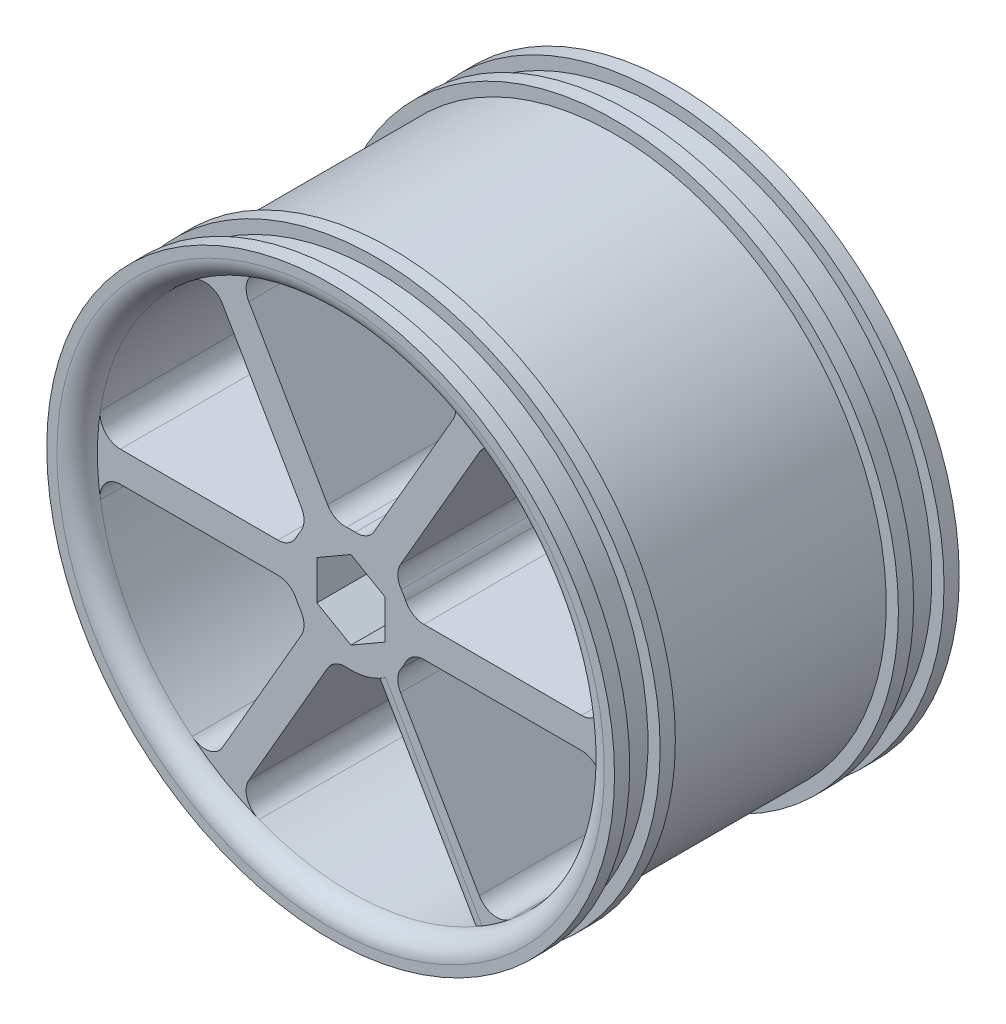
from build123d import *

# Parameters (mm, degrees)
SKETCH2_W           = 25
SKETCH2_H           = 3
BOSS_EXTRUDE1_DEPTH = 32
CIRPATTERN1_COUNT   = 6
SKETCH5_R           = 6
BOSS_EXTRUDE2_DEPTH = 32
AXLEHOLE_DEPTH      = 53.191951405
FILLET1_R           = 2


with BuildPart() as part:
    # Sketch1 → Revolve1 (revolve)
    with BuildSketch(Plane.XZ, mode=Mode.PRIVATE) as revolve1_sk:
        with BuildLine():
            Line((25, 0), (28, 0))
            Line((28, 0), (28, 1.5))
            Line((28, 1.5), (26.8, 1.5))
            Line((26.8, 1.5), (26.8, 4.5))
            Line((26.8, 4.5), (28, 4.5))
            Line((28, 4.5), (28, 6))
            Line((28, 6), (26.8, 6))
            Line((26.8, 6), (26.8, 28))
            Line((26.8, 28), (28, 28))
            Line((28, 28), (28, 29.5))
            Line((28, 29.5), (26.8, 29.5))
            Line((26.8, 29.5), (26.8, 32.5))
            Line((26.8, 32.5), (28, 32.5))
            Line((28, 32.5), (28, 33.999996833))
            Line((28, 33.999996833), (27, 33.999996833))
            ThreePointArc((27, 33.999996833), (25.585786438, 33.414213562), (25, 32))
            Line((25, 32), (25, 0))
        make_face()
    revolve(revolve1_sk.sketch.rotate(Axis((0, 0, 34), (0, 0, -1)), 180), axis=Axis((0, 0, 34), (0, 0, -1)))

    # Sketch2 → Boss-Extrude1 (add)
    with BuildSketch(Plane.XY):
        with Locations((12.5, 0)):
            Rectangle(SKETCH2_W, SKETCH2_H)
    boss_extrude1 = extrude(amount=BOSS_EXTRUDE1_DEPTH)

    # CirPattern1: Boss-Extrude1 ×6 about axis
    cirpattern1_axis = Axis((0, 0, 0), (0, 0, 1))
    for i in range(1, CIRPATTERN1_COUNT):
        add(boss_extrude1.rotate(cirpattern1_axis, i * 360 / CIRPATTERN1_COUNT))

    # Sketch5 → Boss-Extrude2 (add)
    with BuildSketch(Plane.XY):
        Circle(SKETCH5_R)
    extrude(amount=BOSS_EXTRUDE2_DEPTH)

    # Sketch6 → AxleHole (cut, through all)
    with BuildSketch(Plane.XY):
        Polygon((0, -3.87), (3.351518313, -1.935), (3.351518313, 1.935), (0, 3.87), (-3.351518313, 1.935), (-3.351518313, -1.935), align=None)
    extrude(amount=AXLEHOLE_DEPTH, mode=Mode.SUBTRACT)

    # Fillet1
    # the kernel refuses this fillet: 2 mm, written as the material it adds along each edge
    with BuildSketch(Plane(origin=(-24.954959427, -1.5, 32), x_dir=(0.10620109039764976, -0.9943446728365121, 0), z_dir=(0, 0, -1))) as fillet1_piece_1:
        with BuildLine():
            CenterArc((2.224755634, -1.997850608), FILLET1_R, 87.343441845, 98.752929077)
            Line((0.236066288, -2.210252789), (0.196292501, -2.214500833))
            Line((0.196292501, -2.214500833), (-0.039773787, -0.004248044))
            Line((-0.039773787, -0.004248044), (-0.001853963, 0.039957012))
            ThreePointArc((-0.001853963, 0.039957012), (1.158726893, 0.066867397), (2.319307748, 0.039957012))
            Line((2.319307748, 0.039957012), (2.317453785, 0))
        make_face()
    extrude(amount=32)
    with BuildSketch(Plane(origin=(-13.776517819, -20.861628814, 32), x_dir=(-0.8080272015953212, 0.589145178612228, 0), z_dir=(0, 0, -1)), Plane(origin=(13.776517819, 20.861628814, 32), x_dir=(0.8080272015953204, -0.589145178612229, 0), z_dir=(0, 0, -1)), Plane(origin=(24.954959427, -1.5, 32), x_dir=(-0.10620109039765001, -0.994344672836512, 0), z_dir=(0, 0, -1)), Plane(origin=(-11.178441608, 22.361628814, 32), x_dir=(0.9142282919929711, 0.4051994942242834, 0), z_dir=(0, 0, -1)), Plane(origin=(-24.954959427, 1.5, 32), x_dir=(0.10620109039765026, 0.994344672836512, 0), z_dir=(0, 0, -1))) as fillet1_piece_2:
        with BuildLine():
            CenterArc((2.224755634, 1.997850608), FILLET1_R, 173.903629078, 98.752929077)
            Line((0.236066288, 2.210252789), (0.196292501, 2.214500833))
            Line((0.196292501, 2.214500833), (-0.039773787, 0.004248044))
            Line((-0.039773787, 0.004248044), (-0.001853963, -0.039957012))
            ThreePointArc((-0.001853963, -0.039957012), (1.158726893, -0.066867397), (2.319307748, -0.039957012))
            Line((2.319307748, -0.039957012), (2.317453785, 0))
        make_face()
    extrude(amount=32)
    with BuildSketch(Plane(origin=(-11.178441608, -22.361628814, 32), x_dir=(0.5000000000000002, 0.8660254037844387, 0), z_dir=(0, 0, -1)), Plane(origin=(13.776517819, -20.861628814, 32), x_dir=(-0.5000000000000002, 0.8660254037844387, 0), z_dir=(0, 0, -1)), Plane(origin=(24.954959427, 1.5, 32), x_dir=(-1, 0, 0), z_dir=(0, 0, -1)), Plane(origin=(11.178441608, 22.361628814, 32), x_dir=(-0.4999999999999994, -0.8660254037844389, 0), z_dir=(0, 0, -1)), Plane(origin=(-13.776517819, 20.861628814, 32), x_dir=(0.5000000000000007, -0.8660254037844382, 0), z_dir=(0, 0, -1))) as fillet1_piece_3:
        with BuildLine():
            CenterArc((2.222823584, 2), FILLET1_R, 171.247070923, 98.752929077)
            Line((0.246116119, 2.304347826), (0.20658197, 2.310434783))
            ThreePointArc((0.20658197, 2.310434783), (0.056568819, 1.159275304), (-0.039927935, 0.0024))
            Line((-0.039927935, 0.0024), (0, -0.04))
            Line((0, -0.04), (2.222823584, -0.04))
            Line((2.222823584, -0.04), (2.222823584, 0))
        make_face()
    extrude(amount=32)
    with BuildSketch(Plane(origin=(5.809475019, 1.5, 32), x_dir=(1, 0, 0), z_dir=(0, 0, -1)), Plane(origin=(4.203775615, -4.281152949, 32), x_dir=(0.5000000000000001, -0.8660254037844386, 0), z_dir=(0, 0, -1)), Plane(origin=(1.605699404, 5.781152949, 32), x_dir=(0.4999999999999986, 0.8660254037844394, 0), z_dir=(0, 0, -1)), Plane(origin=(-4.203775615, 4.281152949, 32), x_dir=(-0.5000000000000004, 0.8660254037844384, 0), z_dir=(0, 0, -1)), Plane(origin=(-5.809475019, -1.5, 32), x_dir=(-1, 0, 0), z_dir=(0, 0, -1)), Plane(origin=(-1.605699404, -5.781152949, 32), x_dir=(-0.4999999999999988, -0.8660254037844393, 0), z_dir=(0, 0, -1))) as fillet1_piece_4:
        with BuildLine():
            CenterArc((1.384272266, -2), FILLET1_R, 90, 64.055520228)
            Line((-0.414164556, -1.125), (-0.450133292, -1.1075))
            ThreePointArc((-0.450133292, -1.1075), (-0.216451666, -0.559050695), (-0.038729833, 0.01))
            Line((-0.038729833, 0.01), (0, 0.04))
            Line((0, 0.04), (1.384272266, 0.04))
            Line((1.384272266, 0.04), (1.384272266, 0))
        make_face()
    extrude(amount=32)
    with BuildSketch(Plane(origin=(4.203775615, 4.281152949, 32), x_dir=(0.6399622417657335, -0.7684063567632539, 0), z_dir=(0, 0, -1)), Plane(origin=(5.809475019, -1.5, 32), x_dir=(-0.3454783045035584, -0.9384267372135913, 0), z_dir=(0, 0, -1)), Plane(origin=(-1.605699404, 5.781152949, 32), x_dir=(0.9854405462692932, 0.1700203804503366, 0), z_dir=(0, 0, -1)), Plane(origin=(-5.809475019, 1.5, 32), x_dir=(0.3454783045035597, 0.9384267372135907, 0), z_dir=(0, 0, -1))) as fillet1_piece_5:
        with BuildLine():
            CenterArc((1.398617439, -1.989994715), FILLET1_R, 95.733483793, 64.055520228)
            Line((-0.478236035, -1.299038106), (-0.515773105, -1.285218973))
            Line((-0.515773105, -1.285218973), (-0.037537069, 0.013819132))
            Line((-0.037537069, 0.013819132), (0.00399605, 0.039799894))
            ThreePointArc((0.00399605, 0.039799894), (0.599407474, 0.009984144), (1.194818898, 0.039799894))
            Line((1.194818898, 0.039799894), (1.198814948, 0))
        make_face()
    extrude(amount=32)
    with BuildSketch(Plane(origin=(-4.203775615, -4.281152949, 32), x_dir=(-0.4999999999999996, -0.8660254037844388, 0), z_dir=(0, 0, -1))) as fillet1_piece_6:
        with BuildLine():
            CenterArc((1.384272266, 2), FILLET1_R, 205.944479772, 64.055520228)
            Line((-0.414164556, 1.125), (-0.450133292, 1.1075))
            ThreePointArc((-0.450133292, 1.1075), (-0.216451666, 0.559050695), (-0.038729833, -0.01))
            Line((-0.038729833, -0.01), (0, -0.04))
            Line((0, -0.04), (1.384272266, -0.04))
            Line((1.384272266, -0.04), (1.384272266, 0))
        make_face()
    extrude(amount=32)
    # the kernel refuses this fillet: 2 mm, written as the material it takes off along each edge
    with BuildSketch(Plane(origin=(-0.894300596, -1.45102593, 32), x_dir=(0.8660254037844385, 0.5000000000000003, 0), z_dir=(0.5000000000000003, -0.8660254037844386, 0))) as fillet1_2_piece_1_section:
        with BuildLine():
            CenterArc((FILLET1_R, -FILLET1_R), FILLET1_R, 90, 90)
            Line((0, -FILLET1_R), (-FILLET1_R * 0.02, -FILLET1_R))
            Line((-FILLET1_R * 0.02, -FILLET1_R), (-FILLET1_R * 0.02, FILLET1_R * 0.02))
            Line((-FILLET1_R * 0.02, FILLET1_R * 0.02), (FILLET1_R, FILLET1_R * 0.02))
            Line((FILLET1_R, FILLET1_R * 0.02), (FILLET1_R, 0))
        make_face()
    fillet1_2_piece_1 = extrude(amount=29.145484408, mode=Mode.PRIVATE)
    fillet1_2_piece_1 = fillet1_2_piece_1 - Plane(origin=(0, 0, 31.546531325), x_dir=(1, 0, 0), z_dir=(0, 0, -1)) * Cylinder(6, 67, mode=Mode.PRIVATE)
    fillet1_2_piece_1 = fillet1_2_piece_1 & Plane(origin=(0, 0, 31.546531325), x_dir=(-1, 0, 0), z_dir=(0, 0, -1)) * Cylinder(25, 67, mode=Mode.PRIVATE)
    add(fillet1_2_piece_1, mode=Mode.SUBTRACT)


solid = part.part
